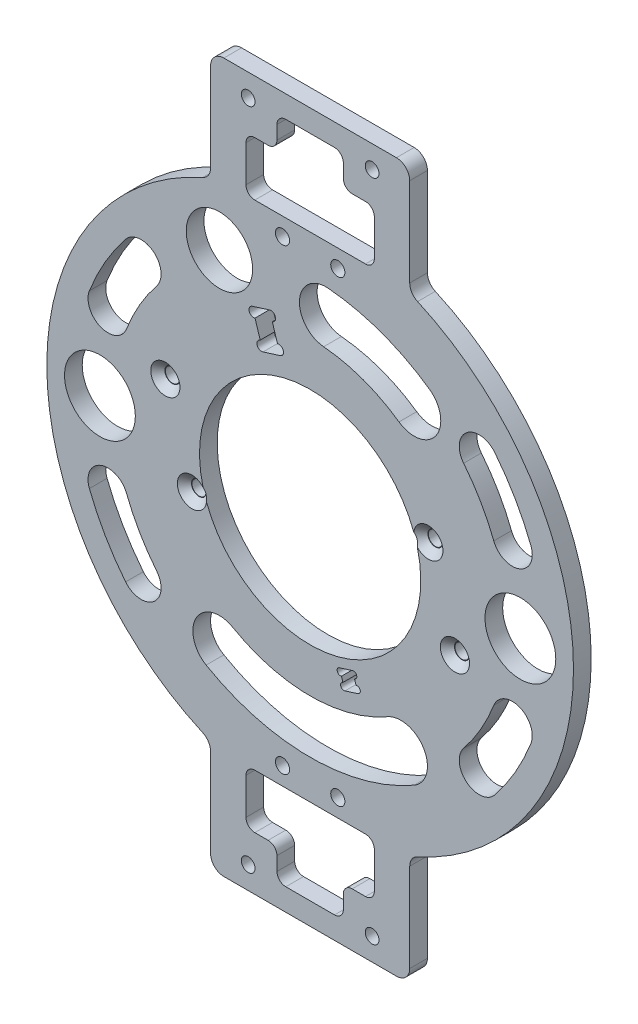
from build123d import *
from build123d.topology import SkipClean

# Parameters (mm, degrees)
SKETCH_1_W           = 120
SKETCH_1_H           = 95
SKETCH_1_R           = 25
EXTRUDE_1_DEPTH      = 4
CUT_EXTRUDE_1_DEPTH  = 10
SKETCH_5_R           = 1.05
CUT_EXTRUDE_2_DEPTH  = 10
SKETCH_6_R           = 1.6
CUT_EXTRUDE_3_DEPTH  = 10
CUT_EXTRUDE_4_DEPTH  = 10
SKETCH_9_R           = 59.5
SKETCH_9_R_2         = 47.5
EXTRUDE_2_DEPTH      = 4
SKETCH_10_R          = 1.55
CUT_EXTRUDE_5_DEPTH  = 10
FILLET_1_R           = 20
FILLET_2_R           = 2
CUT_EXTRUDE_6_DEPTH  = 10
EXTRUDE_START        = -4
EXTRUDE_3_DEPTH      = 4
FILLET_3_R           = 3
SKETCH_14_W          = 15
SKETCH_14_H          = 15.314058647
CUT_EXTRUDE_8_DEPTH  = 10
FILLET_4_R           = 2
SKETCH_15_R          = 0.75
CUT_EXTRUDE_9_DEPTH  = 10
CUT_EXTRUDE_10_DEPTH = 10
FILLET_5_R           = 8
CUT_EXTRUDE_11_DEPTH = 10
FILLET_6_R           = 8
SKETCH_20_R          = 1.55
CUT_EXTRUDE_12_DEPTH = 10
SKETCH_21_R          = 6
SKETCH_21_W          = 29
SKETCH_21_H          = 12.222301231
CUT_EXTRUDE_13_DEPTH = 10
FILLET_7_R           = 2
SKETCH_22_R          = 6
SKETCH_22_R_2        = 1.55
EXTRUDE_4_DEPTH      = 4
CUT_EXTRUDE_14_DEPTH = 4
CUT_EXTRUDE_15_DEPTH = 5
SKETCH_25_R          = 1.6
CUT_EXTRUDE_16_DEPTH = 5
SKETCH_26_R          = 8
SKETCH_26_R_2        = 7.5
CUT_EXTRUDE_17_DEPTH = 5


with BuildPart() as part:
    # 草图1 → 凸台-拉伸1 (new body)
    with BuildSketch(Plane.XY):
        Rectangle(SKETCH_1_W, SKETCH_1_H)
        Circle(SKETCH_1_R, mode=Mode.SUBTRACT)
    extrude(amount=EXTRUDE_1_DEPTH)

    # 草图4 → 切除-拉伸1 (cut)
    with BuildSketch(Plane.XY.offset(4)):
        Polygon((-13.08807764, 34.72185513), (-10.65418341, 26.996173356), (-6.743653129, 28.22814451), (-9.17754736, 35.953826284), align=None)
    extrude(amount=-CUT_EXTRUDE_1_DEPTH, mode=Mode.SUBTRACT)

    # 草图5 → 切除-拉伸2 (cut)
    with BuildSketch(Plane.XY.offset(4)):
        with Locations((-12.772572833, 33.720377863)):
            Circle(SKETCH_5_R)
        with Locations((-8.862042552, 34.952349017)):
            Circle(SKETCH_5_R)
        with Locations((-10.969688217, 27.997650623)):
            Circle(SKETCH_5_R)
        with Locations((-7.059157937, 29.229621777)):
            Circle(SKETCH_5_R)
    extrude(amount=-CUT_EXTRUDE_2_DEPTH, mode=Mode.SUBTRACT)

    # 草图6 → 切除-拉伸3 (cut)
    with BuildSketch(Plane.XY.offset(4)):
        with Locations((-26.706060453, -8.413461538)):
            Circle(SKETCH_6_R)
        with Locations((-32.715675838, 10.662295928)):
            Circle(SKETCH_6_R)
        with Locations((32.715675838, -10.662295928)):
            Circle(SKETCH_6_R)
        with Locations((26.706060453, 8.413461538)):
            Circle(SKETCH_6_R)
    extrude(amount=-CUT_EXTRUDE_3_DEPTH, mode=Mode.SUBTRACT)

    # 草图7 → 切除-拉伸4 (cut)
    with BuildSketch(Plane.XY.offset(4)):
        Polygon((6.619585527, -26.170328379), (7.851556681, -30.080858659), (10.808299088, -29.149368275), (9.576327934, -25.238837994), align=None)
    extrude(amount=-CUT_EXTRUDE_4_DEPTH, mode=Mode.SUBTRACT)

    # 草图9 → 凸台-拉伸2 (add)
    with BuildSketch(Plane.XY.offset(4)):
        Circle(SKETCH_9_R)
        Circle(SKETCH_9_R_2, mode=Mode.SUBTRACT)
    extrude(amount=-EXTRUDE_2_DEPTH)

    # 草图10 → 切除-拉伸5 (cut)
    with BuildSketch(Plane(origin=(0, 0, 0), x_dir=(-1, 0, 0), z_dir=(0, 0, -1))):
        with Locations((22.410594264, 47.350689169)):
            Circle(SKETCH_10_R)
        with Locations((33.146611169, 40.566299659)):
            Circle(SKETCH_10_R)
        with Locations((-33.146611169, -40.566299659)):
            Circle(SKETCH_10_R)
        with Locations((-22.410594264, -47.350689169)):
            Circle(SKETCH_10_R)
        with BuildLine():
            Line((54.096724193, 1.339563938), (53.817029982, -5.654846055))
            ThreePointArc((53.817029982, -5.654846055), (49.140820137, -9.971449058), (44.824217134, -5.295239212))
            Line((44.824217134, -5.295239212), (45.103911345, 1.699170781))
            ThreePointArc((45.103911345, 1.699170781), (49.780121191, 6.015773783), (54.096724193, 1.339563938))
        make_face()
        with BuildLine():
            Line((-44.824217134, 5.295239212), (-45.103911345, -1.699170781))
            ThreePointArc((-45.103911345, -1.699170781), (-49.780121191, -6.015773783), (-54.096724193, -1.339563938))
            Line((-54.096724193, -1.339563938), (-53.817029982, 5.654846055))
            ThreePointArc((-53.817029982, 5.654846055), (-49.140820137, 9.971449058), (-44.824217134, 5.295239212))
        make_face()
    extrude(amount=-CUT_EXTRUDE_5_DEPTH, mode=Mode.SUBTRACT)

    # 圆角1
    fillet_1_edges = [part.edges().sort_by_distance(p)[0] for p in [
        (60, -47.5, 2),
        (-60, -47.5, 2),
        (-60, 47.5, 2),
        (60, 47.5, 2),
    ]]
    fillet(fillet_1_edges, radius=FILLET_1_R)

    # 圆角2
    fillet_2_edges = [part.edges().sort_by_distance(p)[0] for p in [
        (35.832945734, -47.5, 2),
        (-35.832945734, -47.5, 2),
        (35.832945734, 47.5, 2),
        (-35.832945734, 47.5, 2),
    ]]
    fillet(fillet_2_edges, radius=FILLET_2_R)

    # 草图11 → 切除-拉伸6 (cut)
    with BuildSketch(Plane(origin=(0, 0, 0), x_dir=(-1, 0, 0), z_dir=(0, 0, -1))):
        with BuildLine():
            ThreePointArc((-7.45801173, 48.934937019), (-28.509092849, 40.465808097), (-43.569521887, 23.493547253))
            ThreePointArc((-43.569521887, 23.493547253), (-40.62910136, 13.671178541), (-30.806732647, 16.611599068))
            ThreePointArc((-30.806732647, 16.611599068), (-20.157944439, 28.612187543), (-5.273341627, 34.600460518))
            ThreePointArc((-5.273341627, 34.600460518), (0.801561572, 42.86003382), (-7.45801173, 48.934937019))
        make_face()
        with BuildLine():
            ThreePointArc((7.45801173, -48.934937019), (28.509092849, -40.465808097), (43.569521887, -23.493547253))
            ThreePointArc((43.569521887, -23.493547253), (40.62910136, -13.671178541), (30.806732647, -16.611599068))
            ThreePointArc((30.806732647, -16.611599068), (20.157944439, -28.612187543), (5.273341627, -34.600460518))
            ThreePointArc((5.273341627, -34.600460518), (-0.801561572, -42.86003382), (7.45801173, -48.934937019))
        make_face()
    extrude(amount=-CUT_EXTRUDE_6_DEPTH, mode=Mode.SUBTRACT)

    # 草图12 → 凸台-拉伸3 (add)
    with BuildSketch(Plane(origin=(0, 0, 0), x_dir=(-1, 0, 0), z_dir=(0, 0, -1)).offset(EXTRUDE_START)):
        with BuildLine():
            Line((-22.5, 55.081757416), (-22.5, 80.081757416))
            Line((-22.5, 80.081757416), (22.5, 80.081757416))
            Line((22.5, 80.081757416), (22.5, 55.081757416))
            ThreePointArc((22.5, 55.081757416), (0, 59.5), (-22.5, 55.081757416))
        make_face()
    extrude_3 = extrude(amount=EXTRUDE_3_DEPTH)

    # 镜向1: 凸台-拉伸3 across plane
    add(extrude_3.mirror(Plane.ZX))

    # 圆角3
    fillet_3_edges = [part.edges().sort_by_distance(p)[0] for p in [
        (-22.5, 55.081757416, 2),
        (22.5, 55.081757416, 2),
        (22.5, 80.081757416, 2),
        (-22.5, 80.081757416, 2),
        (22.5, -80.081757416, 2),
        (-22.5, -80.081757416, 2),
        (-22.5, -55.081757416, 2),
        (22.5, -55.081757416, 2),
    ]]
    fillet(fillet_3_edges, radius=FILLET_3_R)

    # 草图14 → 切除-拉伸8 (cut)
    with BuildSketch(Plane(origin=(0, 0, 0), x_dir=(-1, 0, 0), z_dir=(0, 0, -1))):
        with Locations((0, 67.424728093)):
            Rectangle(SKETCH_14_W, SKETCH_14_H)
        with Locations((0, -67.424728093)):
            Rectangle(SKETCH_14_W, SKETCH_14_H)
    extrude(amount=-CUT_EXTRUDE_8_DEPTH, mode=Mode.SUBTRACT)

    # 圆角4
    fillet_4_edges = [part.edges().sort_by_distance(p)[0] for p in [
        (-7.5, 75.081757416, 2),
        (-7.5, 59.767698769, 2),
        (7.5, 59.767698769, 2),
        (7.5, 75.081757416, 2),
        (7.5, -75.081757416, 2),
        (7.5, -59.767698769, 2),
        (-7.5, -59.767698769, 2),
        (-7.5, -75.081757416, 2),
    ]]
    fillet(fillet_4_edges, radius=FILLET_4_R)

    # 草图15 → 切除-拉伸9 (cut)
    with BuildSketch(Plane(origin=(0, 0, 0), x_dir=(-1, 0, 0), z_dir=(0, 0, -1))):
        with Locations((-7.626196104, -29.365517754)):
            Circle(SKETCH_15_R)
        with Locations((-10.582938511, -28.43402737)):
            Circle(SKETCH_15_R)
        with Locations((-6.844946104, -26.885669284)):
            Circle(SKETCH_15_R)
        with Locations((-9.801688511, -25.954178899)):
            Circle(SKETCH_15_R)
    extrude(amount=-CUT_EXTRUDE_9_DEPTH, mode=Mode.SUBTRACT)

    # 草图16 → 切除-拉伸10 (cut)
    with BuildSketch(Plane.XY.offset(4)):
        with BuildLine():
            Line((-40, 41.5), (-26.03110526, 28.432727049))
            ThreePointArc((-26.03110526, 28.432727049), (-49.56404259, 17.276053143), (-40, 41.5))
        make_face()
    extrude(amount=-CUT_EXTRUDE_10_DEPTH, mode=Mode.SUBTRACT)

    # 圆角5
    fillet_5_edges = [part.edges().sort_by_distance(p)[0] for p in [
        (-26.03110526, 28.432727049, 2),
        (-40, 41.5, 2),
    ]]
    fillet(fillet_5_edges, radius=FILLET_5_R)

    # 草图17 → 切除-拉伸11 (cut)
    with BuildSketch(Plane.XY.offset(4)):
        with BuildLine():
            Line((26.03110526, -28.432727049), (40, -41.5))
            ThreePointArc((40, -41.5), (49.56404259, -17.276053143), (26.03110526, -28.432727049))
        make_face()
    extrude(amount=-CUT_EXTRUDE_11_DEPTH, mode=Mode.SUBTRACT)

    # 圆角6
    fillet_6_edges = [part.edges().sort_by_distance(p)[0] for p in [
        (26.03110526, -28.432727049, 2),
        (40, -41.5, 2),
    ]]
    fillet(fillet_6_edges, radius=FILLET_6_R)

    # 高级异型孔1: read off the stored shape, not the designer's step
    # 高级异型孔1: loft between two sections, ruled curve by curve
    other_1_from = [
        Edge.make_three_point_arc((34.415675838, -10.662295928, 2.4), (32.715675838, -8.962295928, 2.4), (31.015675838, -10.662295928, 2.4)),
        Edge.make_three_point_arc((31.015675838, -10.662295928, 2.4), (32.715675838, -12.362295928, 2.4), (34.415675838, -10.662295928, 2.4)),
    ]
    other_1_to = [
        Edge.make_three_point_arc((36.015675838, -10.662295928, 4), (32.715675838, -7.362295928, 4), (29.415675838, -10.662295928, 4)),
        Edge.make_three_point_arc((29.415675838, -10.662295928, 4), (32.715675838, -13.962295928, 4), (36.015675838, -10.662295928, 4)),
    ]
    other_1 = Solid(Shell([*[Face.make_surface_from_curves(other_1_from[k], other_1_to[k]) for k in range(2)], Face(Wire(other_1_from)), Face(Wire(other_1_to))]))
    add(other_1, mode=Mode.SUBTRACT)

    # Other 1 2: loft between two sections, ruled curve by curve
    other_1_2_from = [
        Edge.make_three_point_arc((28.406060453, 8.413461538, 2.4), (26.706060453, 10.113461538, 2.4), (25.006060453, 8.413461538, 2.4)),
        Edge.make_three_point_arc((25.006060453, 8.413461538, 2.4), (26.706060453, 6.713461538, 2.4), (28.406060453, 8.413461538, 2.4)),
    ]
    other_1_2_to = [
        Edge.make_three_point_arc((30.00606046, 8.413461538, 4.000000007), (26.706060453, 11.713461545, 4.000000007), (23.406060446, 8.413461538, 4.000000007)),
        Edge.make_three_point_arc((23.406060446, 8.413461538, 4.000000007), (26.706060453, 5.113461532, 4.000000007), (30.00606046, 8.413461538, 4.000000007)),
    ]
    other_1_2 = Solid(Shell([*[Face.make_surface_from_curves(other_1_2_from[k], other_1_2_to[k]) for k in range(2)], Face(Wire(other_1_2_from)), Face(Wire(other_1_2_to))]))
    add(other_1_2, mode=Mode.SUBTRACT)

    # Other 1 3: loft between two sections, ruled curve by curve
    other_1_3_from = [
        Edge.make_three_point_arc((-25.006060453, -8.413461538, 2.4), (-26.706060453, -6.713461538, 2.4), (-28.406060453, -8.413461538, 2.4)),
        Edge.make_three_point_arc((-28.406060453, -8.413461538, 2.4), (-26.706060453, -10.113461538, 2.4), (-25.006060453, -8.413461538, 2.4)),
    ]
    other_1_3_to = [
        Edge.make_three_point_arc((-23.406060446, -8.413461538, 4.000000007), (-26.706060453, -5.113461532, 4.000000007), (-30.00606046, -8.413461538, 4.000000007)),
        Edge.make_three_point_arc((-30.00606046, -8.413461538, 4.000000007), (-26.706060453, -11.713461545, 4.000000007), (-23.406060446, -8.413461538, 4.000000007)),
    ]
    other_1_3 = Solid(Shell([*[Face.make_surface_from_curves(other_1_3_from[k], other_1_3_to[k]) for k in range(2)], Face(Wire(other_1_3_from)), Face(Wire(other_1_3_to))]))
    add(other_1_3, mode=Mode.SUBTRACT)

    # Other 1 4: loft between two sections, ruled curve by curve
    other_1_4_from = [
        Edge.make_three_point_arc((-31.015675838, 10.662295928, 2.4), (-32.715675838, 12.362295928, 2.4), (-34.415675838, 10.662295928, 2.4)),
        Edge.make_three_point_arc((-34.415675838, 10.662295928, 2.4), (-32.715675838, 8.962295928, 2.4), (-31.015675838, 10.662295928, 2.4)),
    ]
    other_1_4_to = [
        Edge.make_three_point_arc((-29.415675838, 10.662295928, 4), (-32.715675838, 13.962295928, 4), (-36.015675838, 10.662295928, 4)),
        Edge.make_three_point_arc((-36.015675838, 10.662295928, 4), (-32.715675838, 7.362295928, 4), (-29.415675838, 10.662295928, 4)),
    ]
    other_1_4 = Solid(Shell([*[Face.make_surface_from_curves(other_1_4_from[k], other_1_4_to[k]) for k in range(2)], Face(Wire(other_1_4_from)), Face(Wire(other_1_4_to))]))
    add(other_1_4, mode=Mode.SUBTRACT)

    # 草图20 → 切除-拉伸12 (cut)
    with BuildSketch(Plane(origin=(0, 0, 0), x_dir=(-1, 0, 0), z_dir=(0, 0, -1))):
        with Locations((14, -74.99)):
            Circle(SKETCH_20_R)
        with Locations((-14, -74.99)):
            Circle(SKETCH_20_R)
        with Locations((14, 75.01)):
            Circle(SKETCH_20_R)
        with Locations((-14, 75.01)):
            Circle(SKETCH_20_R)
    extrude(amount=-CUT_EXTRUDE_12_DEPTH, mode=Mode.SUBTRACT)

    # 草图21 → 切除-拉伸13 (cut)
    with BuildSketch(Plane.XY.offset(4)):
        with Locations((15, -38)):
            Circle(SKETCH_21_R)
        with Locations((0, 61.898849385)):
            Rectangle(SKETCH_21_W, SKETCH_21_H)
        with Locations((0, -61.878849385)):
            Rectangle(SKETCH_21_W, SKETCH_21_H)
        with BuildLine():
            Line((60, 0), (60, 27.5))
            ThreePointArc((60, 27.5), (54.142135624, 41.642135624), (40, 47.5))
            Line((40, 47.5), (36.657195747, 47.5))
            ThreePointArc((36.657195747, 47.5), (53.849009948, 26.462882073), (60, 0))
        make_face()
        with BuildLine():
            Line((-60, 0), (-60, -27.5))
            ThreePointArc((-60, -27.5), (-54.142135624, -41.642135624), (-40, -47.5))
            Line((-40, -47.5), (-36.657195747, -47.5))
            ThreePointArc((-36.657195747, -47.5), (-53.849009948, -26.462882073), (-60, 0))
        make_face()
    extrude(amount=-CUT_EXTRUDE_13_DEPTH, mode=Mode.SUBTRACT)

    # 圆角7
    fillet_7_edges = [part.edges().sort_by_distance(p)[0] for p in [
        (7.5, 68.01, 2),
        (-7.5, -67.99, 2),
        (-14.5, 68.01, 2),
        (-7.5, 68.01, 2),
        (-14.5, 55.787698769, 2),
        (14.5, 68.01, 2),
        (14.5, 55.787698769, 2),
        (14.5, -67.99, 2),
        (7.5, -67.99, 2),
        (-14.5, -67.99, 2),
        (-14.5, -55.767698769, 2),
        (14.5, -55.767698769, 2),
    ]]
    fillet(fillet_7_edges, radius=FILLET_7_R)

    # 草图22 → 凸台-拉伸4 (add)
    with BuildSketch(Plane.XY.offset(4).offset(EXTRUDE_START)):
        with Locations((15, -38)):
            Circle(SKETCH_22_R)
        with Locations((22.410594264, -47.350689169)):
            Circle(SKETCH_22_R_2)
        with Locations((33.146611169, -40.566299659)):
            Circle(SKETCH_22_R_2)
        with Locations((-33.146611169, 40.566299659)):
            Circle(SKETCH_22_R_2)
        with Locations((-22.410594264, 47.350689169)):
            Circle(SKETCH_22_R_2)
        with BuildLine():
            Line((44.824217134, 5.295239212), (45.103911345, -1.699170781))
            ThreePointArc((45.103911345, -1.699170781), (49.780121191, -6.015773783), (54.096724193, -1.339563938))
            Line((54.096724193, -1.339563938), (53.817029982, 5.654846055))
            ThreePointArc((53.817029982, 5.654846055), (49.140820137, 9.971449058), (44.824217134, 5.295239212))
        make_face()
        with BuildLine():
            Line((28.945971187, -31.159453064), (37.085134073, -38.773273985))
            ThreePointArc((37.085134073, -38.773273985), (41.303230165, -40.833221727), (45.950702956, -40.172376822))
            ThreePointArc((45.950702956, -40.172376822), (49.56404259, -17.276053143), (26.95932289, -22.406794673))
            ThreePointArc((26.95932289, -22.406794673), (26.609576509, -27.087969398), (28.945971187, -31.159453064))
        make_face()
        with BuildLine():
            Line((-54.096724193, 1.339563938), (-53.817029982, -5.654846055))
            ThreePointArc((-53.817029982, -5.654846055), (-49.140820137, -9.971449058), (-44.824217134, -5.295239212))
            Line((-44.824217134, -5.295239212), (-45.103911345, 1.699170781))
            ThreePointArc((-45.103911345, 1.699170781), (-49.780121191, 6.015773783), (-54.096724193, 1.339563938))
        make_face()
        with BuildLine():
            Line((-28.945971187, 31.159453064), (-37.085134073, 38.773273985))
            ThreePointArc((-37.085134073, 38.773273985), (-41.303230165, 40.833221727), (-45.950702956, 40.172376822))
            ThreePointArc((-45.950702956, 40.172376822), (-49.56404259, 17.276053143), (-26.95932289, 22.406794673))
            ThreePointArc((-26.95932289, 22.406794673), (-26.609576509, 27.087969398), (-28.945971187, 31.159453064))
        make_face()
        with BuildLine():
            ThreePointArc((-30.806732647, -16.611599068), (-20.157944439, -28.612187543), (-5.273341627, -34.600460518))
            ThreePointArc((-5.273341627, -34.600460518), (0.801561572, -42.86003382), (-7.45801173, -48.934937019))
            ThreePointArc((-7.45801173, -48.934937019), (-28.509092849, -40.465808097), (-43.569521887, -23.493547253))
            ThreePointArc((-43.569521887, -23.493547253), (-40.62910136, -13.671178541), (-30.806732647, -16.611599068))
        make_face()
        with BuildLine():
            ThreePointArc((30.806732647, 16.611599068), (20.157944439, 28.612187543), (5.273341627, 34.600460518))
            ThreePointArc((5.273341627, 34.600460518), (-0.801561572, 42.86003382), (7.45801173, 48.934937019))
            ThreePointArc((7.45801173, 48.934937019), (28.509092849, 40.465808097), (43.569521887, 23.493547253))
            ThreePointArc((43.569521887, 23.493547253), (40.62910136, 13.671178541), (30.806732647, 16.611599068))
        make_face()
    extrude(amount=EXTRUDE_4_DEPTH)

    # 草图23 → 切除-拉伸14 (cut)
    with SkipClean():  # the faces are left unmerged after this step: merging them gives an invalid solid
        with BuildSketch(Plane.XY.offset(4)):
            with BuildLine():
                Line((36.496575182, -47.5), (40, -47.5))
                ThreePointArc((40, -47.5), (54.142135624, -41.642135624), (60, -27.5))
                Line((60, -27.5), (60, 0))
                ThreePointArc((60, 0), (53.849009948, 26.462882073), (36.657195747, 47.5))
                Line((36.657195747, 47.5), (36.496575182, 47.5))
                ThreePointArc((36.496575182, 47.5), (35.871880134, 47.600064186), (35.309694688, 47.890243902))
                ThreePointArc((35.309694688, 47.890243902), (59.5, 0), (35.309694688, -47.890243902))
                ThreePointArc((35.309694688, -47.890243902), (35.871880134, -47.600064186), (36.496575182, -47.5))
            make_face()
            with BuildLine():
                Line((-36.657195747, -47.5), (-36.496575182, -47.5))
                ThreePointArc((-36.496575182, -47.5), (-35.871880134, -47.600064186), (-35.309694688, -47.890243902))
                ThreePointArc((-35.309694688, -47.890243902), (-59.5, 0), (-35.309694688, 47.890243902))
                ThreePointArc((-35.309694688, 47.890243902), (-35.871880134, 47.600064186), (-36.496575182, 47.5))
                Line((-36.496575182, 47.5), (-40, 47.5))
                ThreePointArc((-40, 47.5), (-54.142135624, 41.642135624), (-60, 27.5))
                Line((-60, 27.5), (-60, 0))
                ThreePointArc((-60, 0), (-53.849009948, -26.462882073), (-36.657195747, -47.5))
            make_face()
        extrude(amount=-CUT_EXTRUDE_14_DEPTH, mode=Mode.SUBTRACT)

    # 草图24 → 切除-拉伸15 (cut)
    with SkipClean():  # the faces are left unmerged after this step: merging them gives an invalid solid
        with BuildSketch(Plane.XY.offset(4)):
            with BuildLine():
                ThreePointArc((49.880799132, 19.343109316), (46.332359102, 26.75), (41.692023621, 33.526484551))
                ThreePointArc((41.692023621, 33.526484551), (35.365233214, 34.213305594), (34.678412171, 27.886515187))
                ThreePointArc((34.678412171, 27.886515187), (38.538130468, 22.25), (41.489636661, 16.089128309))
                ThreePointArc((41.489636661, 16.089128309), (47.312208399, 13.520537577), (49.880799132, 19.343109316))
            make_face()
            with BuildLine():
                ThreePointArc((41.692023621, -33.526484551), (46.332359102, -26.75), (49.880799132, -19.343109316))
                ThreePointArc((49.880799132, -19.343109316), (47.312208399, -13.520537577), (41.489636661, -16.089128309))
                ThreePointArc((41.489636661, -16.089128309), (38.538130468, -22.25), (34.678412171, -27.886515187))
                ThreePointArc((34.678412171, -27.886515187), (35.365233214, -34.213305594), (41.692023621, -33.526484551))
            make_face()
            with BuildLine():
                ThreePointArc((-49.880799132, -19.343109316), (-46.332359102, -26.75), (-41.692023621, -33.526484551))
                ThreePointArc((-41.692023621, -33.526484551), (-35.365233214, -34.213305594), (-34.678412171, -27.886515187))
                ThreePointArc((-34.678412171, -27.886515187), (-38.538130468, -22.25), (-41.489636661, -16.089128309))
                ThreePointArc((-41.489636661, -16.089128309), (-47.312208399, -13.520537577), (-49.880799132, -19.343109316))
            make_face()
            with BuildLine():
                ThreePointArc((-41.692023621, 33.526484551), (-46.332359102, 26.75), (-49.880799132, 19.343109316))
                ThreePointArc((-49.880799132, 19.343109316), (-47.312208399, 13.520537577), (-41.489636661, 16.089128309))
                ThreePointArc((-41.489636661, 16.089128309), (-38.538130468, 22.25), (-34.678412171, 27.886515187))
                ThreePointArc((-34.678412171, 27.886515187), (-35.365233214, 34.213305594), (-41.692023621, 33.526484551))
            make_face()
        extrude(amount=-CUT_EXTRUDE_15_DEPTH, mode=Mode.SUBTRACT)

    # 草图25 → 切除-拉伸16 (cut)
    with SkipClean():  # the faces are left unmerged after this step: merging them gives an invalid solid
        with BuildSketch(Plane.XY.offset(4)):
            with Locations((6.25, 51.75)):
                Circle(SKETCH_25_R)
            with Locations((-6.25, 51.75)):
                Circle(SKETCH_25_R)
            with Locations(Location((-6.25, -51.75, 0), (0, 0, 180))):
                Circle(SKETCH_25_R)
            with Locations(Location((6.25, -51.75, 0), (0, 0, 180))):
                Circle(SKETCH_25_R)
        extrude(amount=-CUT_EXTRUDE_16_DEPTH, mode=Mode.SUBTRACT)

    # 草图26 → 切除-拉伸17 (cut)
    with SkipClean():  # the faces are left unmerged after this step: merging them gives an invalid solid
        with BuildSketch(Plane.XY.offset(4)):
            with Locations((47.5, 0)):
                Circle(SKETCH_26_R)
            with Locations((-47.5, 0)):
                Circle(SKETCH_26_R)
            with Locations((-20.5, 42)):
                Circle(SKETCH_26_R_2)
            with BuildLine():
                ThreePointArc((-23.5, -40.703193978), (0, -47), (23.5, -40.703193978))
                ThreePointArc((23.5, -40.703193978), (25.696152423, -32.507041555), (17.5, -30.310889132))
                ThreePointArc((17.5, -30.310889132), (0, -35), (-17.5, -30.310889132))
                ThreePointArc((-17.5, -30.310889132), (-25.696152423, -32.507041555), (-23.5, -40.703193978))
            make_face()
            with BuildLine():
                ThreePointArc((26.958092508, 38.500146082), (16.074946736, 44.165553177), (4.096319909, 46.82115081))
                ThreePointArc((4.096319909, 46.82115081), (-2.403782736, 41.366917078), (3.050450996, 34.866814433))
                ThreePointArc((3.050450996, 34.866814433), (11.970705016, 32.889241728), (20.075175272, 28.67032155))
                ThreePointArc((20.075175272, 28.67032155), (28.431546156, 30.143775198), (26.958092508, 38.500146082))
            make_face()
        extrude(amount=-CUT_EXTRUDE_17_DEPTH, mode=Mode.SUBTRACT)


solid = part.part
